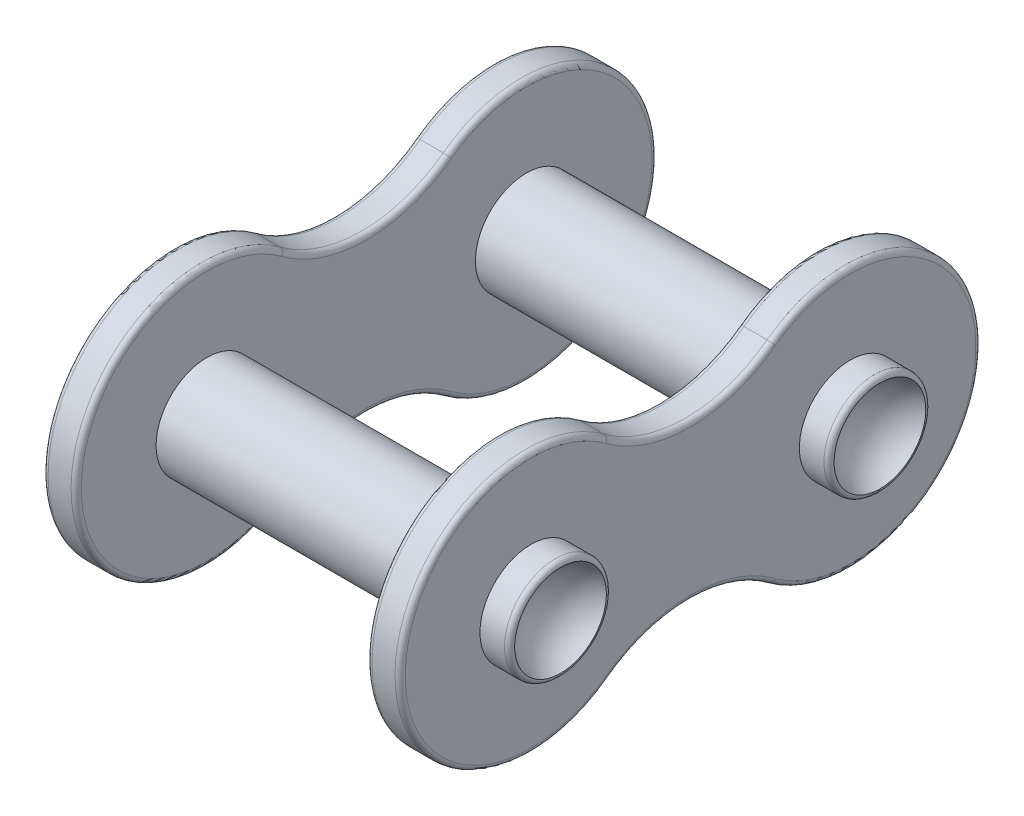
from build123d import *

# Parameters (mm, degrees)
SKETCH2_R           = 2.53
BOSS_EXTRUDE1_DEPTH = 1.65
BOSS_EXTRUDE2_START = -19.225
SKETCH3_R           = 2.53
BOSS_EXTRUDE2_DEPTH = 20.7
FILLET1_R           = 0.254
FILLET2_R           = 0.254


with BuildPart() as part:
    # Sketch2 → Boss-Extrude1 (new body)
    with BuildSketch(Plane(origin=(0, 0, 0), x_dir=(0, 0, -1), z_dir=(1, 0, 0))):
        with BuildLine():
            ThreePointArc((4.05848002, -5.215669084), (14.4375, 0), (4.05848002, 5.215669084))
            ThreePointArc((4.05848002, 5.215669084), (0, 3.871919532), (-4.05848002, 5.215669084))
            ThreePointArc((-4.05848002, 5.215669084), (-14.4375, 0), (-4.05848002, -5.215669084))
            ThreePointArc((-4.05848002, -5.215669084), (0, -3.871919532), (4.05848002, -5.215669084))
        make_face()
        with Locations((7.9375, 0)):
            Circle(SKETCH2_R, mode=Mode.SUBTRACT)
        with Locations(Location((-7.9375, 0, 0), (0, 0, 180))):
            Circle(SKETCH2_R, mode=Mode.SUBTRACT)
    boss_extrude1 = extrude(amount=BOSS_EXTRUDE1_DEPTH)

    # Sketch3 → Boss-Extrude2 (add)
    with BuildSketch(Plane(origin=(1.65, 0, 0), x_dir=(0, 0, -1), z_dir=(1, 0, 0)).offset(BOSS_EXTRUDE2_START)):
        with Locations((7.9375, 0)):
            Circle(SKETCH3_R)
    boss_extrude2 = extrude(amount=BOSS_EXTRUDE2_DEPTH)

    # Mirror1: Boss-Extrude1 across plane
    add(boss_extrude1.mirror(Plane(origin=(-7.225, 0, 0), x_dir=(0, 0, 1), z_dir=(1, 0, 0))))

    # Sketch5 → Cut-Revolve1 (revolve, cut)
    with BuildSketch(Plane(origin=(0, 0, 0), x_dir=(1, 0, 0), z_dir=(0, 1, 0)), mode=Mode.PRIVATE) as cut_revolve1_sk:
        with BuildLine():
            Line((-16.1, 7.9375), (-17.6, 7.9375))
            Line((-17.6, 7.9375), (-17.6, 10.228787847))
            ThreePointArc((-17.6, 10.228787847), (-16.508349934, 9.306806394), (-16.1, 7.9375))
        make_face()
    cut_revolve1 = revolve(cut_revolve1_sk.sketch.rotate(Axis((-16.1, 0, -7.9375), (-1, 0, 0)), 180), axis=Axis((-16.1, 0, -7.9375), (-1, 0, 0)), mode=Mode.SUBTRACT)

    # Mirror2: Boss-Extrude2 across plane
    add(boss_extrude2.mirror(Plane.XY))

    # Mirror3: Cut-Revolve1 across plane
    add(cut_revolve1.mirror(Plane.XY), mode=Mode.SUBTRACT)

    # Mirror4: Cut-Revolve1 across plane
    add(cut_revolve1.mirror(Plane(origin=(-7.225, 0, 0), x_dir=(0, 0, 1), z_dir=(1, 0, 0))), mode=Mode.SUBTRACT)

    # Mirror4 copy 1 sketch → Mirror4 copy 1 (revolve, cut)
    with BuildSketch(Plane(origin=(-14.45, 0, 0), x_dir=(-1, 0, 0), z_dir=(0, 1, 0))):
        with BuildLine():
            Line((-16.1, 7.9375), (-17.6, 7.9375))
            Line((-17.6, 7.9375), (-17.6, 10.228787847))
            ThreePointArc((-17.6, 10.228787847), (-16.508349934, 9.306806394), (-16.1, 7.9375))
        make_face()
    revolve(axis=Axis((1.65, 0, 7.9375), (1, 0, 0)), mode=Mode.SUBTRACT)

    # Fillet1
    # the kernel refuses this fillet: 0.254 mm, written as the material it takes off along each edge
    with BuildSketch(Plane(origin=(-17.575, 0, -7.9375), x_dir=(0, 0, -1), z_dir=(0, -1, 0))) as fillet1_piece_1:
        with BuildLine():
            CenterArc((2.53 - FILLET1_R, FILLET1_R), FILLET1_R, 270, 90)
            Line((2.53 - FILLET1_R, 0), (2.53, 0))
            Line((2.53, 0), (2.53, FILLET1_R))
        make_face()
    revolve(axis=Axis((-17.575, 0, -7.9375), (1, 0, 0)), mode=Mode.SUBTRACT)
    with BuildSketch(Plane(origin=(3.125, 0, -7.9375), x_dir=(0, 0, -1), z_dir=(0, -1, 0))) as fillet1_piece_2:
        with BuildLine():
            CenterArc((2.53 - FILLET1_R, -FILLET1_R), FILLET1_R, 0, 90)
            Line((2.53 - FILLET1_R, 0), (2.53, 0))
            Line((2.53, 0), (2.53, -FILLET1_R))
        make_face()
    revolve(axis=Axis((3.125, 0, -7.9375), (1, 0, 0)), mode=Mode.SUBTRACT)
    with BuildSketch(Plane(origin=(3.125, 0, 7.9375), x_dir=(0, 0, 1), z_dir=(0, -1, 0))) as fillet1_piece_3:
        with BuildLine():
            CenterArc((2.53 - FILLET1_R, FILLET1_R), FILLET1_R, 270, 90)
            Line((2.53 - FILLET1_R, 0), (2.53, 0))
            Line((2.53, 0), (2.53, FILLET1_R))
        make_face()
    revolve(axis=Axis((3.125, 0, 7.9375), (-1, 0, 0)), mode=Mode.SUBTRACT)
    with BuildSketch(Plane(origin=(-17.575, 0, 7.9375), x_dir=(0, 0, 1), z_dir=(0, -1, 0))) as fillet1_piece_4:
        with BuildLine():
            CenterArc((2.53 - FILLET1_R, -FILLET1_R), FILLET1_R, 0, 90)
            Line((2.53 - FILLET1_R, 0), (2.53, 0))
            Line((2.53, 0), (2.53, -FILLET1_R))
        make_face()
    revolve(axis=Axis((-17.575, 0, 7.9375), (-1, 0, 0)), mode=Mode.SUBTRACT)

    # Fillet2
    fillet2_edges = [part.edges().sort_by_distance(p)[0] for p in [
        (1.65, -3.871919532, 0),
        (1.65, 0, -14.4375),
        (-16.1, 3.871919532, 0),
        (-16.1, 0, -14.4375),
        (-16.1, -3.871919532, 0),
        (-16.1, 0, 14.4375),
        (-14.45, 3.871919532, 0),
        (-14.45, 0, 14.4375),
        (-14.45, -3.871919532, 0),
        (-14.45, 0, -14.4375),
        (1.65, 3.871919532, 0),
        (0, 0, -14.4375),
        (0, -3.871919532, 0),
        (0, 0, 14.4375),
        (0, 3.871919532, 0),
        (1.65, 0, 14.4375),
    ]]
    fillet(fillet2_edges, radius=FILLET2_R)


solid = part.part
